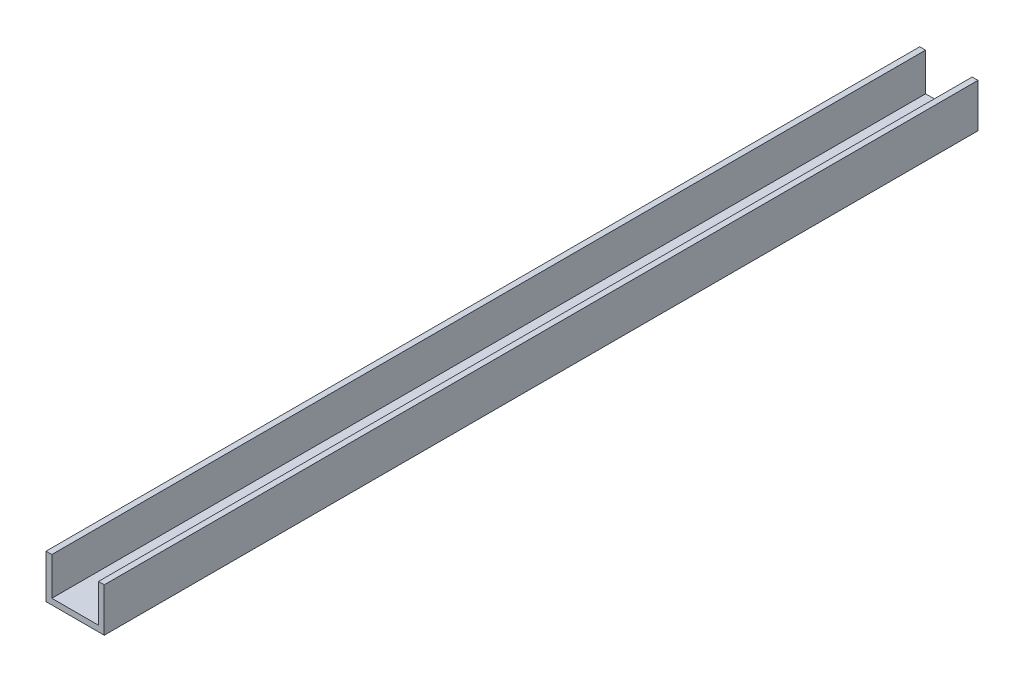
from build123d import *

# Parameters (mm, degrees)
BOSS_EXTRU_1_DEPTH         = 300
ESQUISSE2_R                = 1.6
ENL_V_MAT_EXTRU_1_DEPTH    = 301.541178543
R_P_TITION_LIN_AIRE1_COUNT = 2
R_P_TITION_LIN_AIRE1_PITCH = 115


with BuildPart() as part:
    # Esquisse1 → Boss.-Extru.1 (new body)
    with BuildSketch(Plane.XY):
        Polygon((-10, 0), (10, 0), (10, 15), (8, 15), (8, 2), (-8, 2), (-8, 15), (-10, 15), align=None)
    extrude(amount=BOSS_EXTRU_1_DEPTH)

    # Esquisse2 → Enlèv. mat.-Extru.1 (cut, through all)
    with BuildSketch(Plane.XZ):
        with Locations((0, 6)):
            Circle(ESQUISSE2_R)
        with Locations((0, 20)):
            Circle(ESQUISSE2_R)
    enl_v_mat_extru_1 = extrude(amount=-ENL_V_MAT_EXTRU_1_DEPTH, mode=Mode.SUBTRACT)

    # Répétition linéaire1: Enlèv. mat.-Extru.1 ×2
    with Locations(*[(0, 0, i * R_P_TITION_LIN_AIRE1_PITCH) for i in range(1, R_P_TITION_LIN_AIRE1_COUNT)]):
        add(enl_v_mat_extru_1, mode=Mode.SUBTRACT)


solid = part.part
